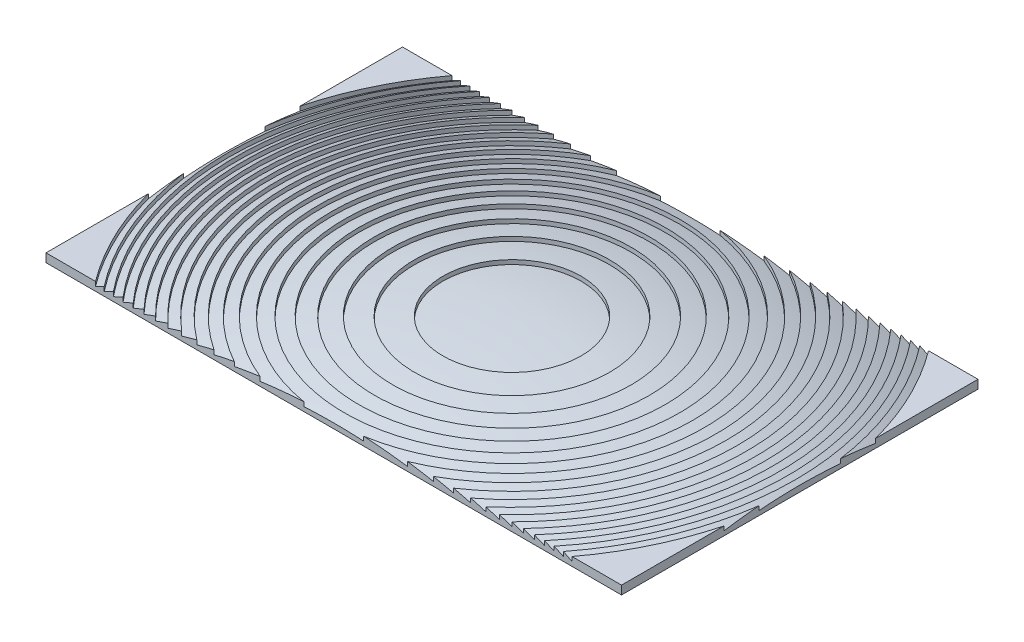
from build123d import *

# Parameters (mm, degrees)
SKETCH1_W           = 134
SKETCH1_H           = 83
BOSS_EXTRUDE1_DEPTH = 1


with BuildPart() as part:
    # Sketch1 → Boss-Extrude1 (new, symmetric)
    with BuildSketch(Plane(origin=(0, 0, 0), x_dir=(1, 0, 0), z_dir=(0, 1, 0))):
        Rectangle(SKETCH1_W, SKETCH1_H)
    extrude(amount=BOSS_EXTRUDE1_DEPTH, both=True)

    # Sketch2 → Cut-Revolve2 (revolve, cut)
    with BuildSketch(Plane.XY):
        with BuildLine():
            ThreePointArc((0, 1), (8.062257748, 0.749759152), (16.093476939, 0))
            Line((16.093476939, 0), (16.093476939, 1))
            ThreePointArc((16.093476939, 1), (19.410995879, 0.542651439), (22.715633383, 0))
            Line((22.715633383, 0), (22.715633383, 1))
            ThreePointArc((22.715633383, 1), (25.246211792, 0.52501241), (27.766886754, 0))
            Line((27.766886754, 0), (27.766886754, 1))
            ThreePointArc((27.766886754, 1), (29.887626002, 0.517705527), (32, 0))
            Line((32, 0), (32, 1))
            ThreePointArc((32, 1), (33.857263243, 0.513687404), (35.707142143, 0))
            Line((35.707142143, 0), (35.707142143, 1))
            ThreePointArc((35.707142143, 1), (37.376136897, 0.511141633), (39.038442592, 0))
            Line((39.038442592, 0), (39.038442592, 1))
            ThreePointArc((39.038442592, 1), (40.563928381, 0.509383102), (42.083250825, 0))
            Line((42.083250825, 0), (42.083250825, 1))
            ThreePointArc((42.083250825, 1), (43.494443758, 0.508095088), (44.899888641, 0))
            Line((44.899888641, 0), (44.899888641, 1))
            ThreePointArc((44.899888641, 1), (46.217118302, 0.507110804), (47.528938553, 0))
            Line((47.528938553, 0), (47.528938553, 1))
            ThreePointArc((47.528938553, 1), (48.767032551, 0.506334009), (50, 0))
            Line((50, 0), (50, 1))
            ThreePointArc((50, 1), (51.170171104, 0.505705258), (52.335456433, 0))
            Line((52.335456433, 0), (52.335456433, 1))
            ThreePointArc((52.335456433, 1), (53.446430452, 0.505185844), (54.552726788, 0))
            Line((54.552726788, 0), (54.552726788, 1))
            ThreePointArc((54.552726788, 1), (55.611454311, 0.504749476), (56.665686266, 0))
            Line((56.665686266, 0), (56.665686266, 1))
            ThreePointArc((56.665686266, 1), (57.677811887, 0.504377668), (58.685603004, 0))
            Line((58.685603004, 0), (58.685603004, 1))
            ThreePointArc((58.685603004, 1), (59.655786026, 0.504057044), (60.621778265, 0))
            Line((60.621778265, 0), (60.621778265, 1))
            ThreePointArc((60.621778265, 1), (61.55391861, 0.503777684), (62.481997407, 0))
            Line((62.481997407, 0), (62.481997407, 1))
            ThreePointArc((62.481997407, 1), (63.379398912, 0.503532075), (64.272855857, 0))
            Line((64.272855857, 0), (64.272855857, 1))
            ThreePointArc((64.272855857, 1), (65.138346949, 0.503314425), (66, 0))
            Line((66, 0), (66, 1))
            ThreePointArc((66, 1), (66.836024616, 0.503120196), (67.668308683, 0))
            Line((67.668308683, 0), (67.668308683, 1))
            ThreePointArc((67.668308683, 1), (68.476995948, 0.50294578), (69.282032303, 0))
            Line((69.282032303, 0), (69.282032303, 2))
            Line((69.282032303, 2), (0, 2))
            Line((0, 2), (0, 1))
        make_face()
    revolve(axis=Axis((0, 0, 0), (0, 1, 0)), mode=Mode.SUBTRACT)


solid = part.part
